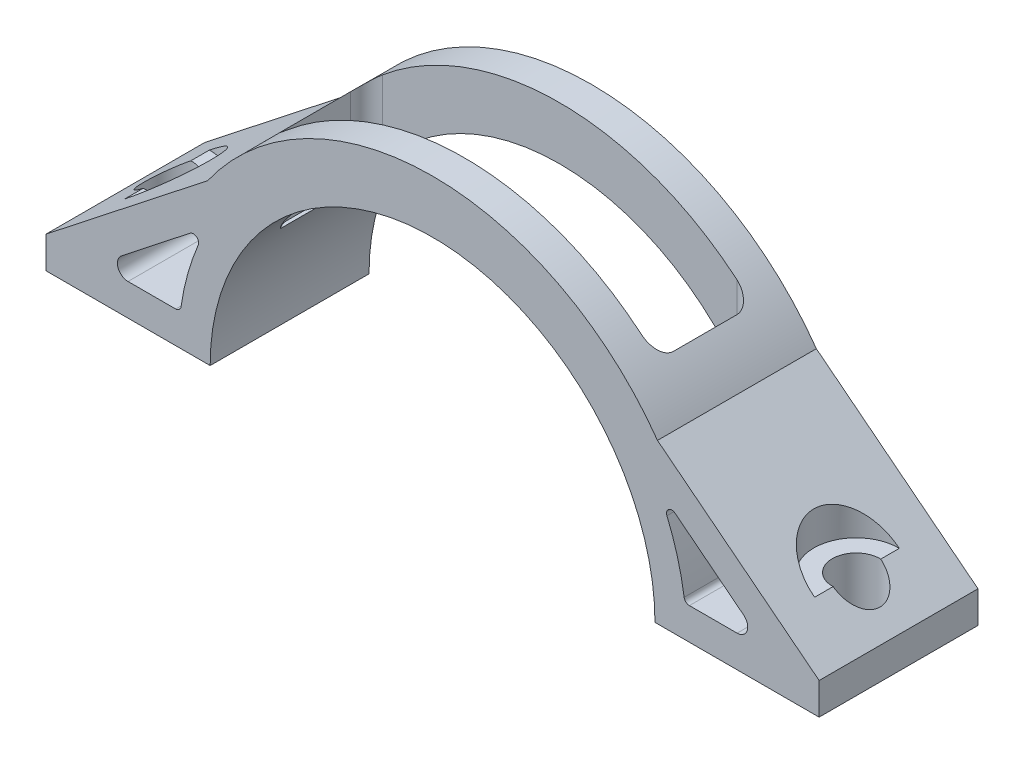
from build123d import *

# Parameters (mm, degrees)
SALIENTE_EXTRUIR1_DEPTH = 7.5
SALIENTE_EXTRUIR2_DEPTH = 7.5
CROQUIS3_R              = 2.25
CORTAR_EXTRUIR1_DEPTH   = 46.436769251
CROQUIS4_R              = 4
CORTAR_EXTRUIR2_DEPTH   = 43.248172742
CORTAR_EXTRUIR3_DEPTH   = 48.257274572
CORTAR_EXTRUIR4_DEPTH   = 15
SIMETR_A3_COPY_1_DEPTH  = 48.257274572


with BuildPart() as part:
    # Croquis1 → Saliente-Extruir1 (new, symmetric)
    with BuildSketch(Plane.XY):
        with BuildLine():
            Line((-26, 0), (-21, 0))
            ThreePointArc((-21, 0), (0, 21), (21, 0))
            Line((21, 0), (26, 0))
            ThreePointArc((26, 0), (0, 26), (-26, 0))
        make_face()
    extrude(amount=SALIENTE_EXTRUIR1_DEPTH, both=True)

    # Croquis2 → Saliente-Extruir2 (add, symmetric)
    with BuildSketch(Plane.XY):
        with BuildLine():
            Line((26, 0), (36.5, 0))
            Line((36.5, 0), (36.5, 3))
            Line((36.5, 3), (21.236760582, 15))
            ThreePointArc((21.236760582, 15), (24.78059498, 7.869060455), (26, 0))
        make_face()
    saliente_extruir2 = extrude(amount=SALIENTE_EXTRUIR2_DEPTH, both=True)

    # Croquis3 → Cortar-Extruir1 (cut, through all)
    with BuildSketch(Plane.XZ):
        with Locations((32.5, 0)):
            Circle(CROQUIS3_R)
    cortar_extruir1 = extrude(amount=-CORTAR_EXTRUIR1_DEPTH, mode=Mode.SUBTRACT)

    # Croquis4 → Cortar-Extruir2 (cut, through all)
    with BuildSketch(Plane(origin=(0, 6.09, 0), x_dir=(-1, 0, 0), z_dir=(0, -1, 0))):
        with Locations((-32.5, 0)):
            Circle(CROQUIS4_R)
    cortar_extruir2 = extrude(amount=-CORTAR_EXTRUIR2_DEPTH, mode=Mode.SUBTRACT)

    # Simetría1: Saliente-Extruir2, Cortar-Extruir1, Cortar-Extruir2 across plane
    add(saliente_extruir2.mirror(Plane(origin=(0, 0, 0), x_dir=(0, 0, 1), z_dir=(1, 0, 0))))
    add(cortar_extruir1.mirror(Plane(origin=(0, 0, 0), x_dir=(0, 0, 1), z_dir=(1, 0, 0))), mode=Mode.SUBTRACT)
    add(cortar_extruir2.mirror(Plane(origin=(0, 0, 0), x_dir=(0, 0, 1), z_dir=(1, 0, 0))), mode=Mode.SUBTRACT)

    # Croquis6 → Cortar-Extruir3 (cut, through all)
    with BuildSketch(Plane.XY.offset(7.5)):
        with BuildLine():
            Line((29.374247447, 4.786131776), (22.898948379, 9.877029369))
            ThreePointArc((22.898948379, 9.877029369), (22.28692582, 9.881701061), (22.128900164, 9.290413206))
            ThreePointArc((22.128900164, 9.290413206), (23.12783497, 6.411181608), (23.753839647, 3.428571429))
            ThreePointArc((23.753839647, 3.428571429), (23.921384471, 3.122035527), (24.248711306, 3))
            Line((24.248711306, 3), (28.756188524, 3))
            ThreePointArc((28.756188524, 3), (29.701210158, 3.672992183), (29.374247447, 4.786131776))
        make_face()
    cortar_extruir3 = extrude(amount=-CORTAR_EXTRUIR3_DEPTH, mode=Mode.SUBTRACT)

    # Simetría2: Cortar-Extruir3 across plane
    add(cortar_extruir3.mirror(Plane.XY), mode=Mode.SUBTRACT)

    # Croquis8 → Cortar-Extruir4 (cut)
    with BuildSketch(Plane(origin=(0, 26, 0), x_dir=(1, 0, 0), z_dir=(0, 1, 0))):
        with BuildLine():
            Line((-16.736760582, -4.5), (16.736760582, -4.5))
            ThreePointArc((16.736760582, -4.5), (17.797420753, -4.060660172), (18.236760582, -3))
            Line((18.236760582, -3), (18.236760582, 3))
            ThreePointArc((18.236760582, 3), (17.797420753, 4.060660172), (16.736760582, 4.5))
            Line((16.736760582, 4.5), (-16.736760582, 4.5))
            ThreePointArc((-16.736760582, 4.5), (-17.797420753, 4.060660172), (-18.236760582, 3))
            Line((-18.236760582, 3), (-18.236760582, -3))
            ThreePointArc((-18.236760582, -3), (-17.797420753, -4.060660172), (-16.736760582, -4.5))
        make_face()
    extrude(amount=-CORTAR_EXTRUIR4_DEPTH, mode=Mode.SUBTRACT)

    # Simetría3: Cortar-Extruir3 across plane
    add(cortar_extruir3.mirror(Plane(origin=(0, 0, 0), x_dir=(0, 0, 1), z_dir=(1, 0, 0))), mode=Mode.SUBTRACT)

    # Simetría3 copy 1 sketch → Simetría3 copy 1 (cut, through all)
    with BuildSketch(Plane(origin=(0, 0, -7.5), x_dir=(-1, 0, 0), z_dir=(0, 0, -1))):
        with BuildLine():
            Line((29.374247447, 4.786131776), (22.898948379, 9.877029369))
            ThreePointArc((22.898948379, 9.877029369), (22.28692582, 9.881701061), (22.128900164, 9.290413206))
            ThreePointArc((22.128900164, 9.290413206), (23.12783497, 6.411181608), (23.753839647, 3.428571429))
            ThreePointArc((23.753839647, 3.428571429), (23.921384471, 3.122035527), (24.248711306, 3))
            Line((24.248711306, 3), (28.756188524, 3))
            ThreePointArc((28.756188524, 3), (29.701210158, 3.672992183), (29.374247447, 4.786131776))
        make_face()
    extrude(amount=-SIMETR_A3_COPY_1_DEPTH, mode=Mode.SUBTRACT)


solid = part.part
